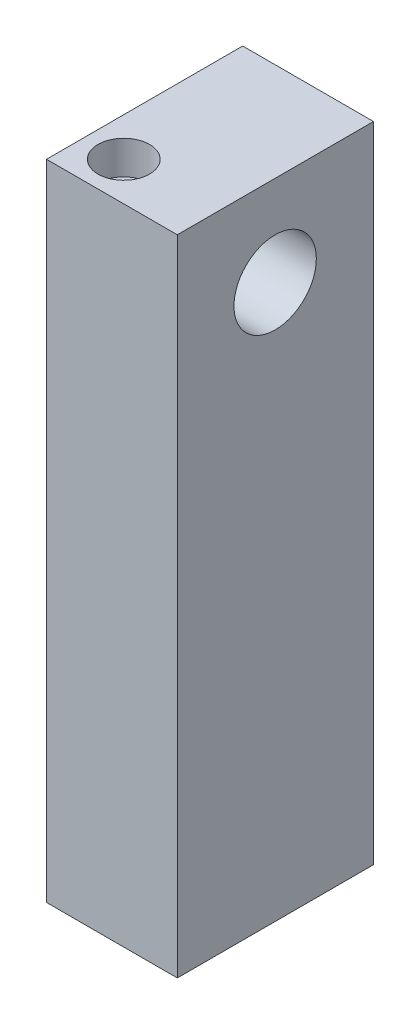
from build123d import *

# Parameters (mm, degrees)
SKETCH1_W           = 50.8
SKETCH1_H           = 76.2
BOSS_EXTRUDE1_DEPTH = 250
SKETCH2_R           = 16
CUT_EXTRUDE1_DEPTH  = 150
SKETCH4_R           = 5.25
CUT_EXTRUDE3_DEPTH  = 60
SKETCH6_R           = 10
CUT_EXTRUDE4_DEPTH  = 13


with BuildPart() as part:
    # Sketch1 → Boss-Extrude1 (new body)
    with BuildSketch(Plane(origin=(0, 0, 0), x_dir=(1, 0, 0), z_dir=(0, 1, 0))):
        with Locations((25.4, 38.1)):
            Rectangle(SKETCH1_W, SKETCH1_H)
    extrude(amount=BOSS_EXTRUDE1_DEPTH)

    # Sketch2 → Cut-Extrude1 (cut)
    with BuildSketch(Plane(origin=(50.8, 0, 0), x_dir=(0, 0, -1), z_dir=(1, 0, 0))):
        with Locations((38, 215)):
            Circle(SKETCH2_R)
    extrude(amount=-CUT_EXTRUDE1_DEPTH, mode=Mode.SUBTRACT)

    # Sketch4 → Cut-Extrude3 (cut)
    with BuildSketch(Plane(origin=(0, 250, 0), x_dir=(1, 0, 0), z_dir=(0, 1, 0))):
        with Locations((15, 15)):
            Circle(SKETCH4_R)
    extrude(amount=-CUT_EXTRUDE3_DEPTH, mode=Mode.SUBTRACT)

    # Sketch6 → Cut-Extrude4 (cut)
    with BuildSketch(Plane(origin=(0, 250, 0), x_dir=(1, 0, 0), z_dir=(0, 1, 0))):
        with Locations((15, 15)):
            Circle(SKETCH6_R)
    extrude(amount=-CUT_EXTRUDE4_DEPTH, mode=Mode.SUBTRACT)


solid = part.part
